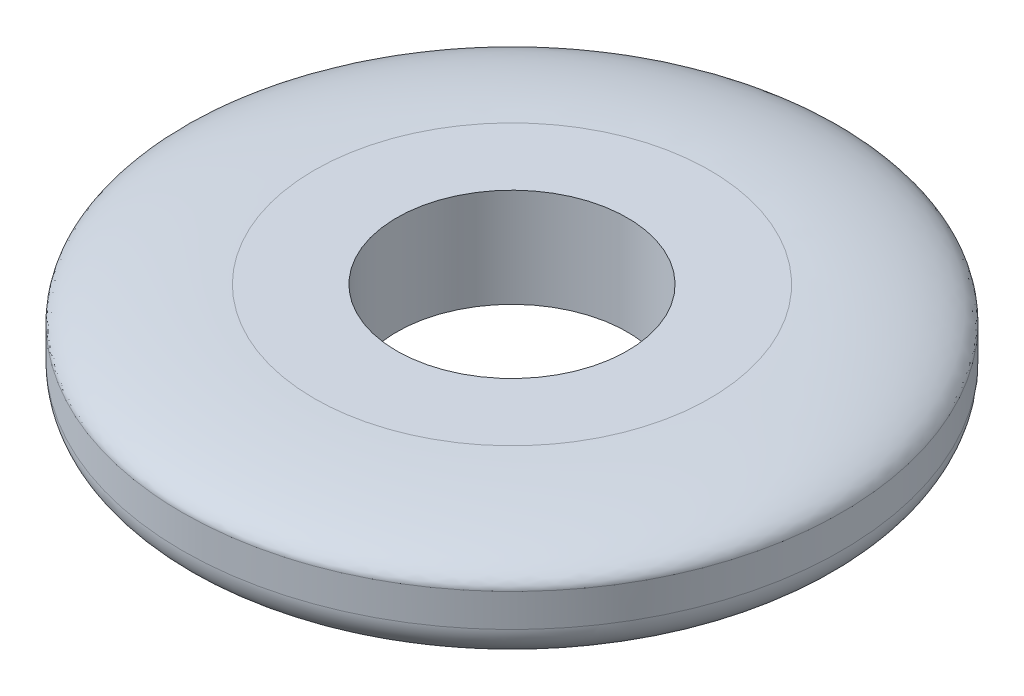
from build123d import *

# Parameters (mm, degrees)
SKETCH1_R           = 10
SKETCH1_R_2         = 3.5
BOSS_EXTRUDE1_DEPTH = 3
FILLET1_SIZE        = 1
FILLET1_SIZE_2      = 4
FILLET2_R           = 1


with BuildPart() as part:
    # Sketch1 → Boss-Extrude1 (new body)
    with BuildSketch(Plane(origin=(0, 0, 0), x_dir=(1, 0, 0), z_dir=(0, 1, 0))):
        with Locations(Location((0, 0, 0), (0, 0, 270))):
            Circle(SKETCH1_R)
        with Locations(Location((0, 0, 0), (0, 0, 270))):
            Circle(SKETCH1_R_2, mode=Mode.SUBTRACT)
    extrude(amount=BOSS_EXTRUDE1_DEPTH)

    # Fillet1
    # an asymmetric fillet: 4, 1 mm, written as the material it takes off along each edge
    with BuildSketch(Plane(origin=(0, 3, 0), x_dir=(0, 0, 1), z_dir=(-1, 0, 0))) as fillet1_piece_1:
        with BuildLine():
            Bezier((10, -FILLET1_SIZE), (10, 0), (10 - FILLET1_SIZE_2, 0), weights=[1, 0.707106781, 1])
            Line((10 - FILLET1_SIZE_2, 0), (10, 0))
            Line((10, 0), (10, -FILLET1_SIZE))
        make_face()
    revolve(axis=Axis((0, 3, 0), (0, 1, 0)), mode=Mode.SUBTRACT)

    # Fillet2
    fillet2_edges = [part.edges().sort_by_distance(p)[0] for p in [
        (0, 0, -10),
    ]]
    fillet(fillet2_edges, radius=FILLET2_R)


solid = part.part
